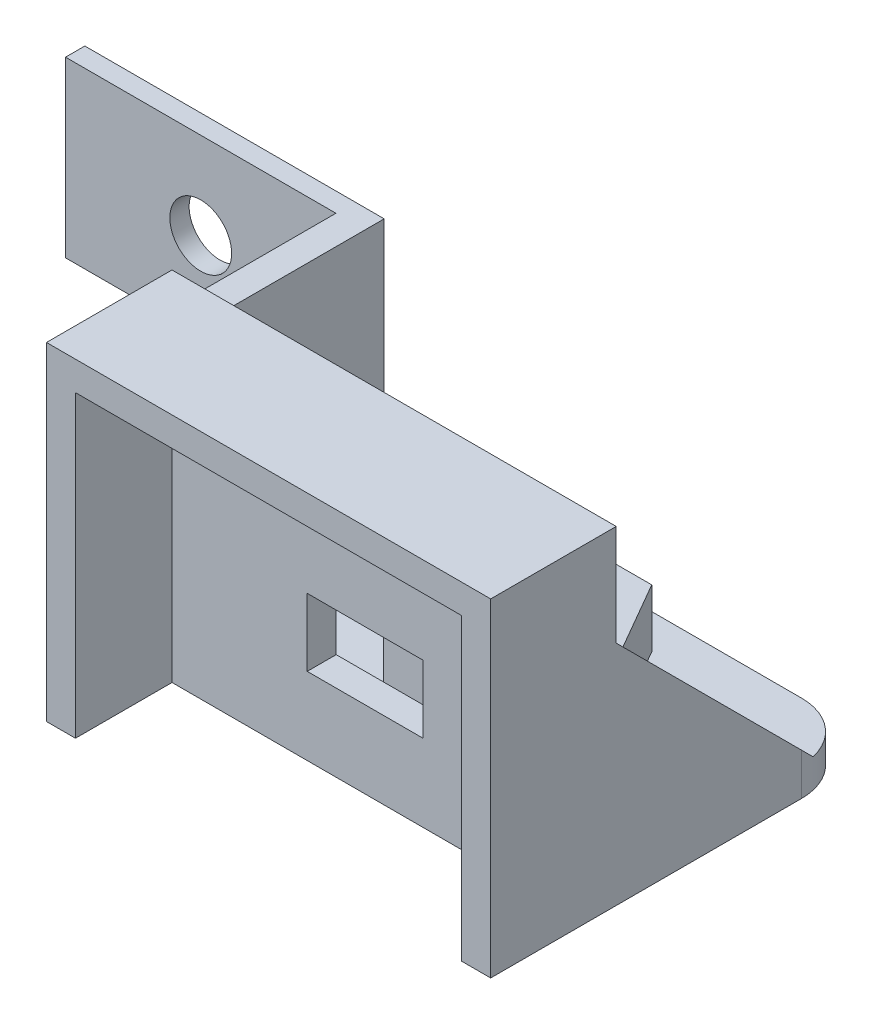
from build123d import *

# Parameters (mm, degrees)
SKETCH_1_W          = 23
SKETCH_1_H          = 17
EXTRUDE_1_DEPTH     = 6.5
SKETCH_2_W          = 20
SKETCH_2_H          = 15.5
CUT_EXTRUDE_1_DEPTH = 5
SKETCH_3_W          = 23
SKETCH_3_H          = 1.5
EXTRUDE_2_DEPTH     = 12.6
EXTRUDE_3_DEPTH     = 3
HOLE_WIZARD_M3_1_D  = 3.2
EXTRUDE_START       = 10
EXTRUDE_6_DEPTH     = 1.5
FILLET_1_R          = 3
SKETCH_10_W         = 1.5
SKETCH_10_H         = 9
EXTRUDE_7_DEPTH     = 9.486304789
SKETCH_11_W         = 1
SKETCH_11_H         = 9
EXTRUDE_8_DEPTH     = 14
HOLE_WIZARD_M3_2_D  = 3.2
CUT_EXTRUDE_2_REACH = 31.686
SKETCH_14_W         = 6
SKETCH_14_H         = 3.5


# Read off the part's stored shape, not the designer's step: 凸台-拉伸6
with BuildPart() as part:
    # 草图1 → 凸台-拉伸1 (new body)
    with BuildSketch(Plane.XY):
        Rectangle(SKETCH_1_W, SKETCH_1_H)
    extrude(amount=EXTRUDE_1_DEPTH)

    # 草图2 → 切除-拉伸1 (cut)
    with BuildSketch(Plane.XY.offset(6.5)):
        with Locations((0, -0.75)):
            Rectangle(SKETCH_2_W, SKETCH_2_H)
    extrude(amount=-CUT_EXTRUDE_1_DEPTH, mode=Mode.SUBTRACT)

    # 草图3 → 凸台-拉伸2 (add)
    with BuildSketch(Plane(origin=(0, 0, 0), x_dir=(-1, 0, 0), z_dir=(0, 0, -1))):
        with Locations((0, -7.75)):
            Rectangle(SKETCH_3_W, SKETCH_3_H)
    extrude(amount=EXTRUDE_2_DEPTH)

    # 草图4 → 凸台-拉伸3 (add)
    with BuildSketch(Plane(origin=(0, -7, 0), x_dir=(1, 0, 0), z_dir=(0, 1, 0))):
        Polygon((5.080682369, 6.4), (2.540341184, 10.8), (-2.540341184, 10.8), (-5.080682369, 6.4), (-2.540341184, 2), (2.540341184, 2), align=None)
        Polygon((3.348631561, 6.4), (1.674315781, 9.3), (-1.674315781, 9.3), (-3.348631561, 6.4), (-1.674315781, 3.5), (1.674315781, 3.5), align=None, mode=Mode.SUBTRACT)
    extrude(amount=EXTRUDE_3_DEPTH)

    # M3 间隙孔1 (through all)
    with Locations(Plane(origin=(0, -7, 0), x_dir=(1, 0, 0), z_dir=(0, 1, 0))):
        with Locations((0, 6.4)):
            Hole(HOLE_WIZARD_M3_1_D / 2)

    # 凸台-拉伸6 outline → 凸台-拉伸6 (add)
    with BuildSketch(Plane.YZ.offset(EXTRUDE_START)):
        Polygon((-7, -10.266991259), (3.266991259, 0), (-7, 0), align=None)
    extrude(amount=EXTRUDE_6_DEPTH)

    # 圆角1
    fillet_1_edges = [part.edges().sort_by_distance(p)[0] for p in [
        (-11.5, -7.75, -12.6),
        (11.5, -7.75, -12.6),
    ]]
    fillet(fillet_1_edges, radius=FILLET_1_R)

    # 草图10 → 凸台-拉伸7 (add)
    with BuildSketch(Plane(origin=(0, 0, 0), x_dir=(-1, 0, 0), z_dir=(0, 0, -1))):
        with Locations((10.75, 2.3)):
            Rectangle(SKETCH_10_W, SKETCH_10_H)
    extrude(amount=EXTRUDE_7_DEPTH)

    # 草图11 → 凸台-拉伸8 (add)
    with BuildSketch(Plane.ZY.offset(11.5)):
        with Locations((-8.986304789, 2.3)):
            Rectangle(SKETCH_11_W, SKETCH_11_H)
    extrude(amount=EXTRUDE_8_DEPTH)

    # M3 间隙孔2 (through all)
    with Locations(Plane.XY.offset(-8.486304789)):
        with Locations((-18.5, 2.3)):
            Hole(HOLE_WIZARD_M3_2_D / 2)

    # 草图14 → 切除-拉伸2 (cut, up to next)
    with BuildSketch(Plane(origin=(0, 0, 0), x_dir=(-1, 0, 0), z_dir=(0, 0, -1)), mode=Mode.PRIVATE) as cut_extrude_2_sk1:
        with Locations((0, -2.75)):
            Rectangle(SKETCH_14_W, SKETCH_14_H)
    cut_extrude_2_tool1 = extrude(cut_extrude_2_sk1.sketch, amount=-CUT_EXTRUDE_2_REACH, mode=Mode.PRIVATE) & part.part
    add(cut_extrude_2_tool1.solids().sort_by_distance((0, -2.75, 0))[0], mode=Mode.SUBTRACT)


solid = part.part
